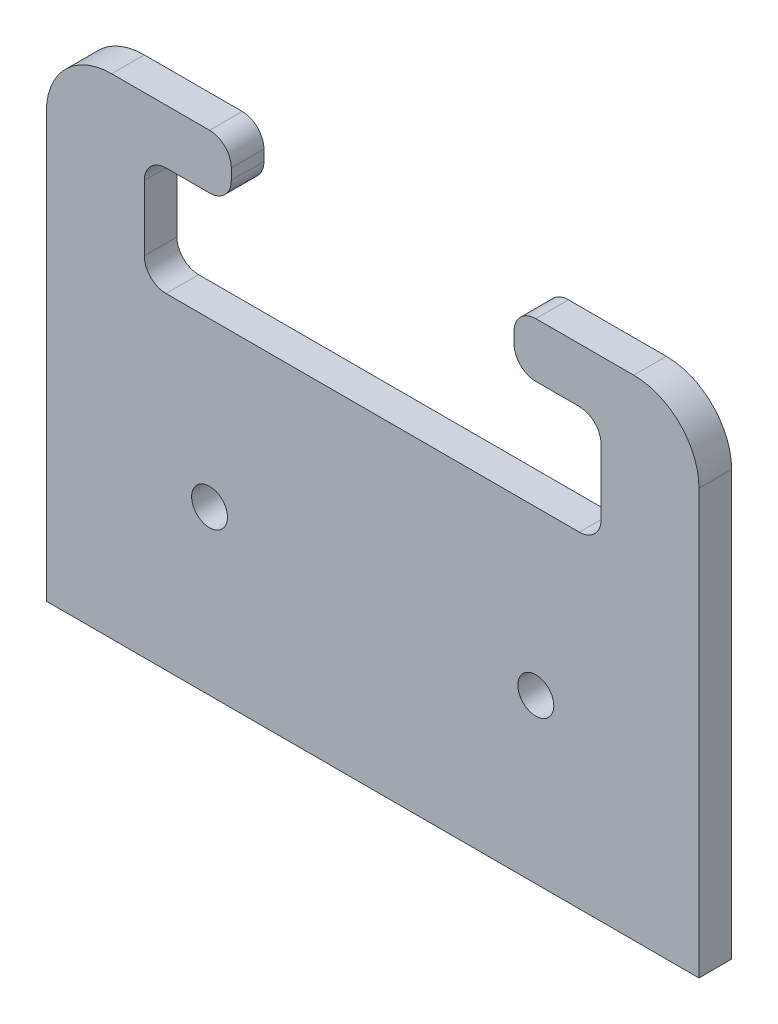
from build123d import *

# Parameters (mm, degrees)
EXTRUDE_1_DEPTH     = 3
FILLET_1_R          = 6
FILLET_2_R          = 2
SKETCH_2_R          = 1.65
CUT_EXTRUDE_1_DEPTH = 5


with BuildPart() as part:
    # 草图1 → 凸台-拉伸1 (new body)
    with BuildSketch(Plane.XY):
        Polygon((13, 22.5), (30, 22.5), (30, -22.5), (-30, -22.5), (-30, 22.5), (-13, 22.5), (-13, 17.5), (-21, 17.5), (-21, 7.5), (21, 7.5), (21, 17.5), (13, 17.5), align=None)
    extrude(amount=EXTRUDE_1_DEPTH)

    # 圆角1
    fillet_1_edges = [part.edges().sort_by_distance(p)[0] for p in [
        (30, 22.5, 1.5),
        (-30, 22.5, 1.5),
    ]]
    fillet(fillet_1_edges, radius=FILLET_1_R)

    # 圆角2
    fillet_2_edges = [part.edges().sort_by_distance(p)[0] for p in [
        (21, 17.5, 1.5),
        (21, 7.5, 1.5),
        (-21, 7.5, 1.5),
        (-21, 17.5, 1.5),
        (-13, 17.5, 1.5),
        (-13, 22.5, 1.5),
        (13, 17.5, 1.5),
        (13, 22.5, 1.5),
    ]]
    fillet(fillet_2_edges, radius=FILLET_2_R)

    # 草图2 → 切除-拉伸1 (cut)
    with BuildSketch(Plane.XY.offset(3)):
        with Locations((-15, -7.5)):
            Circle(SKETCH_2_R)
        with Locations((15, -7.5)):
            Circle(SKETCH_2_R)
    extrude(amount=-CUT_EXTRUDE_1_DEPTH, mode=Mode.SUBTRACT)


solid = part.part
